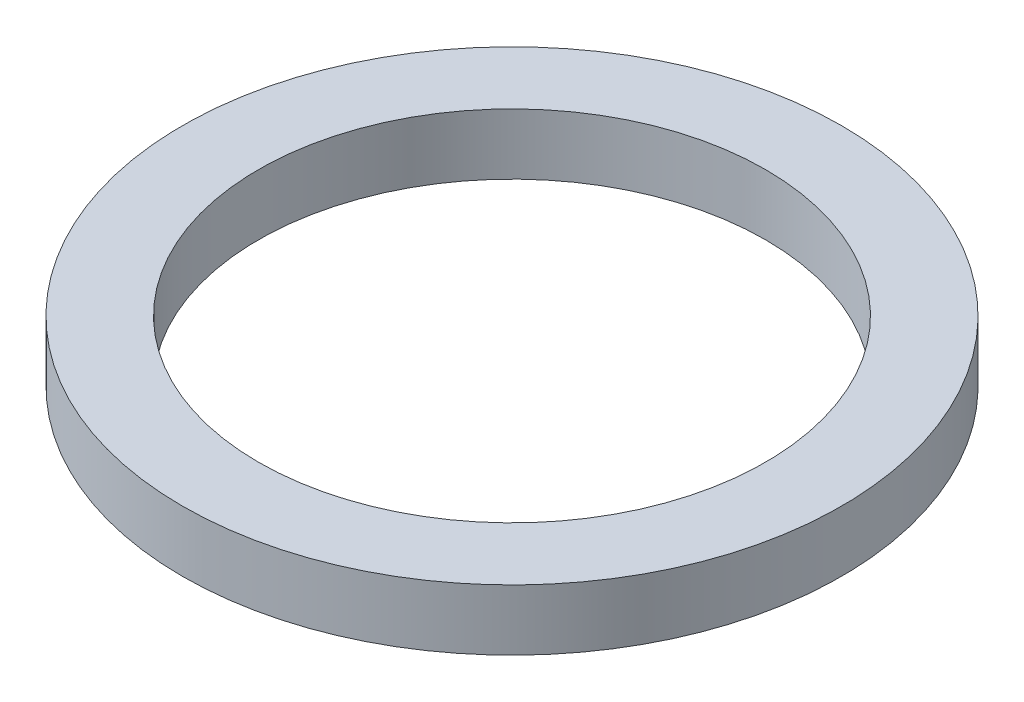
from build123d import *

# Parameters (mm, degrees)
SKETCH1_R           = 65
BOSS_EXTRUDE1_DEPTH = 12
SKETCH2_R           = 50
CUT_EXTRUDE1_DEPTH  = 93.703829479


with BuildPart() as part:
    # Sketch1 → Boss-Extrude1 (new body)
    with BuildSketch(Plane(origin=(0, 0, 0), x_dir=(1, 0, 0), z_dir=(0, 1, 0))):
        Circle(SKETCH1_R)
    extrude(amount=BOSS_EXTRUDE1_DEPTH)

    # Sketch2 → Cut-Extrude1 (cut, through all)
    with BuildSketch(Plane(origin=(0, 0, 0), x_dir=(1, 0, 0), z_dir=(0, 1, 0))):
        Circle(SKETCH2_R)
    extrude(amount=CUT_EXTRUDE1_DEPTH, mode=Mode.SUBTRACT)


solid = part.part
